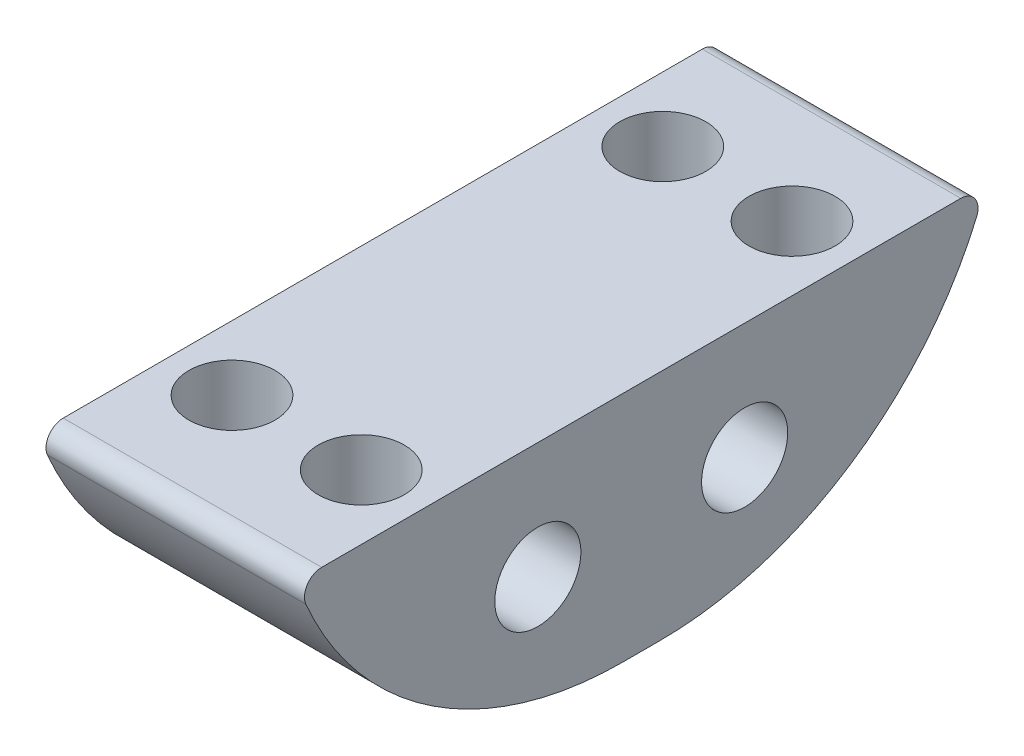
from build123d import *

# Parameters (mm, degrees)
SKETCH1_W           = 30
SKETCH1_H           = 80
BOSS_EXTRUDE1_DEPTH = 27
SKETCH2_R           = 5
CUT_EXTRUDE1_DEPTH  = 40
FILLET5_R           = 40
FILLET6_R           = 40
FILLET7_R           = 2
FILLET8_R           = 2
SKETCH6_R           = 5
CUT_EXTRUDE3_DEPTH  = 10


with BuildPart() as part:
    # Sketch1 → Boss-Extrude1 (new body)
    with BuildSketch(Plane(origin=(0, 0, 0), x_dir=(1, 0, 0), z_dir=(0, 1, 0))):
        Rectangle(SKETCH1_W, SKETCH1_H)
    extrude(amount=BOSS_EXTRUDE1_DEPTH)

    # Sketch2 → Cut-Extrude1 (cut)
    with BuildSketch(Plane(origin=(15, 0, 0), x_dir=(0, 0, -1), z_dir=(1, 0, 0))):
        with Locations((-12, 13.5)):
            Circle(SKETCH2_R)
        with Locations(Location((12, 13.5, 0), (0, 0, 180))):
            Circle(SKETCH2_R)
    extrude(amount=-CUT_EXTRUDE1_DEPTH, mode=Mode.SUBTRACT)

    # Fillet5
    # the kernel refuses this fillet: 40 mm, written as the material it takes off along each edge
    with BuildSketch(Plane(origin=(109.571401597, 0, -40), x_dir=(0, 0, 1), z_dir=(-1, 0, 0))) as fillet5_piece_1:
        with BuildLine():
            CenterArc((37.828560639, 40), FILLET5_R, 198.965574989, 71.034425011)
            Line((0, 27), (-0.756571213, 26.74))
            ThreePointArc((-0.756571213, 26.74), (-0.8, 13.5), (-0.8, 0))
            Line((-0.8, 0), (0, -0.8))
            Line((0, -0.8), (37.828560639, -0.8))
            Line((37.828560639, -0.8), (37.828560639, 0))
        make_face()
    extrude(amount=219.142803194, mode=Mode.SUBTRACT)

    # Fillet6
    # the kernel refuses this fillet: 40 mm, written as the material it takes off along each edge
    with BuildSketch(Plane(origin=(-109.571401597, 0, 40), x_dir=(0, 1, 0), z_dir=(1, 0, 0))) as fillet6_piece_1:
        with BuildLine():
            CenterArc((40, -37.828560639), FILLET6_R, 108.965574989, 71.034425011)
            Line((0, -37.828560639), (-0.8, -37.828560639))
            Line((-0.8, -37.828560639), (-0.8, 0))
            Line((-0.8, 0), (0, 0.8))
            ThreePointArc((0, 0.8), (13.5, 0.8), (26.74, 0.756571213))
            Line((26.74, 0.756571213), (27, 0))
        make_face()
    extrude(amount=219.142803194, mode=Mode.SUBTRACT)

    # Fillet7
    fillet7_edges = [part.edges().sort_by_distance(p)[0] for p in [
        (0, 27, -40),
    ]]
    fillet(fillet7_edges, radius=FILLET7_R)

    # Fillet8
    fillet8_edges = [part.edges().sort_by_distance(p)[0] for p in [
        (0, 27, 40),
    ]]
    fillet(fillet8_edges, radius=FILLET8_R)

    # Sketch6 → Cut-Extrude3 (cut)
    with BuildSketch(Plane(origin=(0, 27, 0), x_dir=(1, 0, 0), z_dir=(0, 1, 0))):
        with Locations(Location((-7.5, 25, 0), (0, 0, 270))):
            Circle(SKETCH6_R)
        with Locations(Location((7.5, 25, 0), (0, 0, 270))):
            Circle(SKETCH6_R)
        with Locations(Location((7.5, -25, 0), (0, 0, 90))):
            Circle(SKETCH6_R)
        with Locations(Location((-7.5, -25, 0), (0, 0, 90))):
            Circle(SKETCH6_R)
    extrude(amount=-CUT_EXTRUDE3_DEPTH, mode=Mode.SUBTRACT)


solid = part.part
